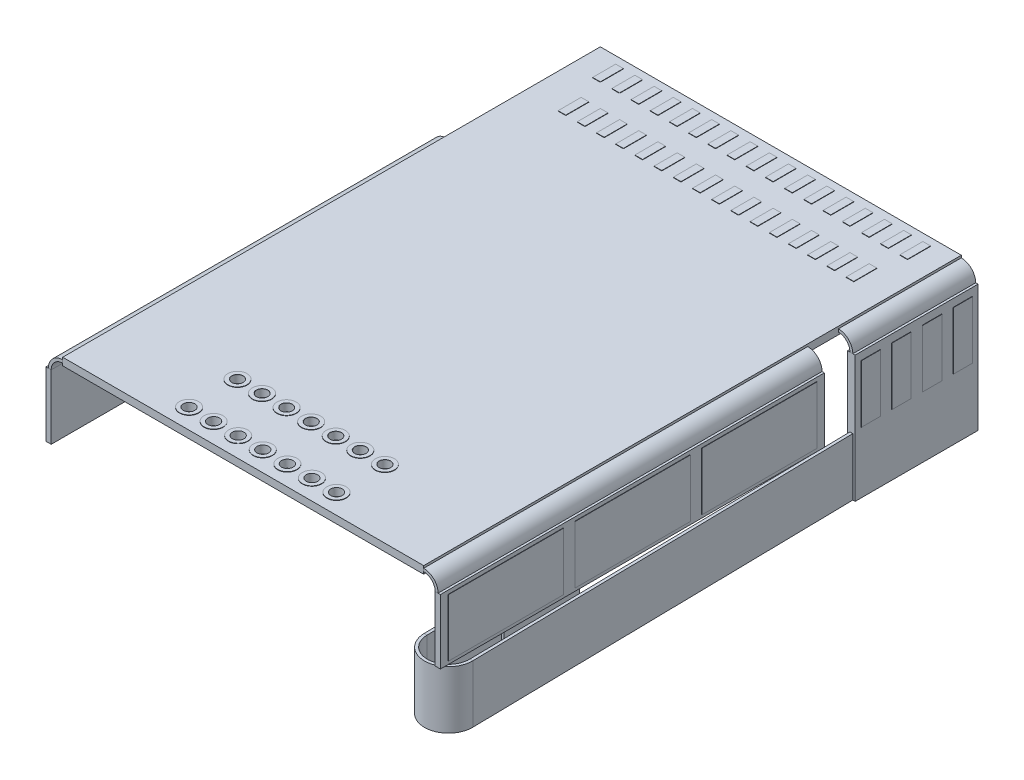
from build123d import *

# Parameters (mm, degrees)
SKETCH1_W                  = 9.4
SKETCH1_H                  = 14
BASE_FLANGE2_DEPTH         = 0.075
EDGE_FLANGE3_DEPTH         = 3.2
EDGE_FLANGE10_DEPTH        = 1.5
HEM4_START                 = -3.675
HEM4_DEPTH                 = 1.5
EDGE_FLANGE11_DEPTH        = 10
EDGE_FLANGE12_DEPTH        = 10
SKETCH50_W                 = 9.4
SKETCH50_H                 = 14
BOSS_EXTRUDE3_DEPTH        = 0.06
SKETCH51_W                 = 9.4
SKETCH51_H                 = 14
BOSS_EXTRUDE4_DEPTH        = 0.06
SKETCH79_W                 = 10
SKETCH79_H                 = 1.679903811
BOSS_EXTRUDE17_DEPTH       = 0.06
SKETCH80_W                 = 10
SKETCH80_H                 = 1.679903811
BOSS_EXTRUDE18_DEPTH       = 0.06
BOSS_EXTRUDE10_DEPTH       = 0.06
BOSS_EXTRUDE11_DEPTH       = 0.06
SKETCH66_W                 = 3.2
SKETCH66_H                 = 3.3
BOSS_EXTRUDE12_DEPTH       = 0.06
SKETCH67_W                 = 3.2
SKETCH67_H                 = 3.3
BOSS_EXTRUDE13_DEPTH       = 0.06
SKETCH68_W                 = 0.5
SKETCH68_H                 = 1.5
BOSS_EXTRUDE14_DEPTH       = 0.01
F_0_3_0_3_DIAMETER_HOLE1_D = 0.3
SKETCH71_R                 = 0.250054371
SKETCH71_R_2               = 0.15
BOSS_EXTRUDE15_DEPTH       = 0.01
SKETCH72_W                 = 0.2
SKETCH72_H                 = 0.6
BOSS_EXTRUDE16_DEPTH       = 0.01
SKETCH81_W                 = 3
SKETCH81_H                 = 1.5
BOSS_EXTRUDE19_DEPTH       = 0.01


# Read off the part's stored shape, not the designer's step: Hem4
# Sheet-metal steps are written as plain solids
with BuildPart() as part:
    # Sketch1 → Base-Flange2 (new body)
    with BuildSketch(Plane(origin=(0, 0, 0), x_dir=(1, 0, 0), z_dir=(0, 1, 0))):
        with Locations((0, -7)):
            Rectangle(SKETCH1_W, SKETCH1_H)
    extrude(amount=-BASE_FLANGE2_DEPTH)

    # Edge-Flange3 section (across the edge) → Edge-Flange3 (add)
    with BuildSketch(Plane(origin=(5, -0.075, 0), x_dir=(-1, 0, 0), z_dir=(0, 0, 1))):
        with BuildLine():
            Line((-0.075, 0.3), (-0.075, 3.6))
            Line((-0.075, 3.6), (0, 3.6))
            Line((0, 3.6), (0, 0.3))
            ThreePointArc((0, 0.3), (0.087867966, 0.087867966), (0.3, 0))
            Line((0.3, 0), (0.3, -0.075))
            ThreePointArc((0.3, -0.075), (0.034834957, 0.034834957), (-0.075, 0.3))
        make_face()
    extrude(amount=EDGE_FLANGE3_DEPTH)

    # Edge-Flange10 section (across the edge) → Edge-Flange10 (add)
    with BuildSketch(Plane(origin=(5.075, -2.175, 3.200872687), x_dir=(0.9998476951563914, 3.4163591665845785e-15, -0.017452406437276774), z_dir=(0, -1, 0))):
        with BuildLine():
            Line((-0.075, 0.000872687), (-0.075, 10.069345485))
            Line((-0.075, 10.069345485), (0, 10.069345485))
            Line((0, 10.069345485), (0, 0.000872687))
            ThreePointArc((0, 0.000872687), (3.808e-06, 3.3e-08), (1.523e-05, -0.000872554))
            Line((1.523e-05, -0.000872554), (-0.074973347, -0.002181484))
            ThreePointArc((-0.074973347, -0.002181484), (-0.074993337, -0.000654457), (-0.075, 0.000872687))
        make_face()
    extrude(amount=EDGE_FLANGE10_DEPTH)

    # Hem4 outline → Hem4 (add)
    with BuildSketch(Plane(origin=(0, 0, 0), x_dir=(1, 0, 0), z_dir=(0, 1, 0)).offset(HEM4_START)):
        with BuildLine():
            Line((4.006539953, -9.314796551), (3.931551375, -9.316105481))
            Line((3.931551375, -9.316105481), (4.000924691, -13.29050007))
            ThreePointArc((4.000924691, -13.29050007), (4.636737254, -13.904497125), (5.25073431, -13.268684562))
            Line((5.25073431, -13.268684562), (5.175745733, -13.269993492))
            ThreePointArc((5.175745733, -13.269993492), (4.635428324, -13.829508548), (4.075913268, -13.289191139))
            Line((4.075913268, -13.289191139), (4.006539953, -9.314796551))
        make_face()
    extrude(amount=HEM4_DEPTH)

    # Edge-Flange11 section (across the edge) → Edge-Flange11 (add)
    with BuildSketch(Plane(origin=(5, -0.075, 4), x_dir=(-1, 0, 0), z_dir=(0, 0, 1))):
        with BuildLine():
            Line((-0.075, 0.3), (-0.075, 1.979903811))
            Line((-0.075, 1.979903811), (0, 1.979903811))
            Line((0, 1.979903811), (0, 0.3))
            ThreePointArc((0, 0.3), (0.087867966, 0.087867966), (0.3, 0))
            Line((0.3, 0), (0.3, -0.075))
            ThreePointArc((0.3, -0.075), (0.034834957, 0.034834957), (-0.075, 0.3))
        make_face()
    extrude(amount=EDGE_FLANGE11_DEPTH)

    # Edge-Flange12 section (across the edge) → Edge-Flange12 (add)
    with BuildSketch(Plane(origin=(-5, -0.075, 14), x_dir=(1, 0, 0), z_dir=(0, 0, -1))):
        with BuildLine():
            Line((-0.075, 0.3), (-0.075, 1.979903811))
            Line((-0.075, 1.979903811), (0, 1.979903811))
            Line((0, 1.979903811), (0, 0.3))
            ThreePointArc((0, 0.3), (0.087867966, 0.087867966), (0.3, 0))
            Line((0.3, 0), (0.3, -0.075))
            ThreePointArc((0.3, -0.075), (0.034834957, 0.034834957), (-0.075, 0.3))
        make_face()
    extrude(amount=EDGE_FLANGE12_DEPTH)

    # Sketch50 → Boss-Extrude3 (add)
    with BuildSketch(Plane(origin=(0, 0, 0), x_dir=(1, 0, 0), z_dir=(0, 1, 0))):
        with Locations((0, -7)):
            Rectangle(SKETCH50_W, SKETCH50_H)
    extrude(amount=BOSS_EXTRUDE3_DEPTH)

    # Sketch51 → Boss-Extrude4 (add)
    with BuildSketch(Plane.XZ.offset(0.075)):
        with Locations((0, 7)):
            Rectangle(SKETCH51_W, SKETCH51_H)
    extrude(amount=BOSS_EXTRUDE4_DEPTH)

    # Sketch79 → Boss-Extrude17 (add)
    with BuildSketch(Plane(origin=(5.075, 0, 0), x_dir=(0, 0, -1), z_dir=(1, 0, 0))):
        with Locations((-9, -1.214951905)):
            Rectangle(SKETCH79_W, SKETCH79_H)
    extrude(amount=BOSS_EXTRUDE17_DEPTH)

    # Sketch80 → Boss-Extrude18 (add)
    with BuildSketch(Plane.ZY.offset(5.075)):
        with Locations((9, -1.214951905)):
            Rectangle(SKETCH80_W, SKETCH80_H)
    extrude(amount=BOSS_EXTRUDE18_DEPTH)

    # Sketch64 → Boss-Extrude10 (add)
    with BuildSketch(Plane(origin=(3.767790182, 0, -0.065767022), x_dir=(0.017452406437276805, 0, 0.9998476951563915), z_dir=(-0.9998476951563915, -2.8857195987886393e-15, 0.017452406437276805))):
        Polygon((9.383301626, -2.925), (9.383301626, -1.425), (11.383301626, -1.425), (11.383301626, -2.725), (11.383301626, -4.425), (9.383301626, -4.425), align=None)
    extrude(amount=BOSS_EXTRUDE10_DEPTH)

    # Sketch65 → Boss-Extrude11 (add)
    with BuildSketch(Plane(origin=(3.842778759, 0, -0.067075953), x_dir=(-0.01745240643727681, 0, -0.9998476951563915), z_dir=(0.9998476951563915, 2.8857195987886393e-15, -0.01745240643727681))):
        Polygon((-9.383301626, -2.925), (-9.383301626, -1.425), (-11.383301626, -1.425), (-11.383301626, -2.925), (-11.383301626, -4.425), (-9.383301626, -4.425), align=None)
    extrude(amount=BOSS_EXTRUDE11_DEPTH)

    # Sketch66 → Boss-Extrude12 (add)
    with BuildSketch(Plane(origin=(5.075, 0, 0), x_dir=(0, 0, -1), z_dir=(1, 0, 0))):
        with Locations((-1.6, -2.025)):
            Rectangle(SKETCH66_W, SKETCH66_H)
    extrude(amount=BOSS_EXTRUDE12_DEPTH)

    # Sketch67 → Boss-Extrude13 (add)
    with BuildSketch(Plane.ZY.offset(-5)):
        with Locations((1.6, -2.025)):
            Rectangle(SKETCH67_W, SKETCH67_H)
    extrude(amount=BOSS_EXTRUDE13_DEPTH)

    # Sketch68 → Boss-Extrude14 (add)
    with BuildSketch(Plane(origin=(5.135, 0, 0), x_dir=(0, 0, -1), z_dir=(1, 0, 0))):
        with Locations((-2, -1.324960776)):
            Rectangle(SKETCH68_W, SKETCH68_H)
        with Locations((-2.8, -1.324960776)):
            Rectangle(SKETCH68_W, SKETCH68_H)
        with Locations((-1.2, -1.324960776)):
            Rectangle(SKETCH68_W, SKETCH68_H)
        with Locations((-0.4, -1.324960776)):
            Rectangle(SKETCH68_W, SKETCH68_H)
    extrude(amount=BOSS_EXTRUDE14_DEPTH)

    # Ø0.3 (0.3) Diameter Hole1 (through all)
    with Locations(Plane(origin=(0, 0.06, 0), x_dir=(1, 0, 0), z_dir=(0, 1, 0))):
        with Locations((-1.92, -13.49), (-1.28, -13.49), (-0.64, -13.49), (0, -13.49), (0.64, -13.49), (1.28, -13.49), (1.92, -13.49), (-1.28, -12.22), (-0.64, -12.22), (0, -12.22), (0.64, -12.22), (1.28, -12.22), (1.92, -12.22), (-1.92, -12.22)):
            Hole(F_0_3_0_3_DIAMETER_HOLE1_D / 2)

    # Sketch71 → Boss-Extrude15 (add)
    # profile 1 of 14: a face of its own
    with BuildSketch(Plane(origin=(0, 0.06, 0), x_dir=(1, 0, 0), z_dir=(0, 1, 0))):
        with Locations(Location((-1.92, -13.49, 0), (0, 0, 270))):
            Circle(SKETCH71_R)
        with Locations(Location((-1.92, -13.49, 0), (0, 0, 270))):
            Circle(SKETCH71_R_2, mode=Mode.SUBTRACT)
    # profile 2 of 14: a face of its own
    with BuildSketch(Plane(origin=(0, 0.06, 0), x_dir=(1, 0, 0), z_dir=(0, 1, 0))):
        with Locations(Location((-1.28, -13.49, 0), (0, 0, 270))):
            Circle(SKETCH71_R)
        with Locations(Location((-1.28, -13.49, 0), (0, 0, 270))):
            Circle(SKETCH71_R_2, mode=Mode.SUBTRACT)
    # profile 3 of 14: a face of its own
    with BuildSketch(Plane(origin=(0, 0.06, 0), x_dir=(1, 0, 0), z_dir=(0, 1, 0))):
        with Locations(Location((-0.64, -13.49, 0), (0, 0, 270))):
            Circle(SKETCH71_R)
        with Locations(Location((-0.64, -13.49, 0), (0, 0, 270))):
            Circle(SKETCH71_R_2, mode=Mode.SUBTRACT)
    # profile 4 of 14: a face of its own
    with BuildSketch(Plane(origin=(0, 0.06, 0), x_dir=(1, 0, 0), z_dir=(0, 1, 0))):
        with Locations(Location((0, -13.49, 0), (0, 0, 270))):
            Circle(SKETCH71_R)
        with Locations(Location((0, -13.49, 0), (0, 0, 270))):
            Circle(SKETCH71_R_2, mode=Mode.SUBTRACT)
    # profile 5 of 14: a face of its own
    with BuildSketch(Plane(origin=(0, 0.06, 0), x_dir=(1, 0, 0), z_dir=(0, 1, 0))):
        with Locations(Location((0.64, -13.49, 0), (0, 0, 270))):
            Circle(SKETCH71_R)
        with Locations(Location((0.64, -13.49, 0), (0, 0, 270))):
            Circle(SKETCH71_R_2, mode=Mode.SUBTRACT)
    # profile 6 of 14: a face of its own
    with BuildSketch(Plane(origin=(0, 0.06, 0), x_dir=(1, 0, 0), z_dir=(0, 1, 0))):
        with Locations(Location((1.28, -13.49, 0), (0, 0, 270))):
            Circle(SKETCH71_R)
        with Locations(Location((1.28, -13.49, 0), (0, 0, 270))):
            Circle(SKETCH71_R_2, mode=Mode.SUBTRACT)
    # profile 7 of 14: a face of its own
    with BuildSketch(Plane(origin=(0, 0.06, 0), x_dir=(1, 0, 0), z_dir=(0, 1, 0))):
        with Locations(Location((1.92, -13.49, 0), (0, 0, 270))):
            Circle(SKETCH71_R)
        with Locations(Location((1.92, -13.49, 0), (0, 0, 270))):
            Circle(SKETCH71_R_2, mode=Mode.SUBTRACT)
    # profile 8 of 14: a face of its own
    with BuildSketch(Plane(origin=(0, 0.06, 0), x_dir=(1, 0, 0), z_dir=(0, 1, 0))):
        with Locations(Location((-1.28, -12.23, 0), (0, 0, 270))):
            Circle(SKETCH71_R)
        with Locations(Location((-1.28, -12.23, 0), (0, 0, 1.910213172))):
            Circle(SKETCH71_R_2, mode=Mode.SUBTRACT)
    # profile 9 of 14: a face of its own
    with BuildSketch(Plane(origin=(0, 0.06, 0), x_dir=(1, 0, 0), z_dir=(0, 1, 0))):
        with Locations(Location((-0.64, -12.23, 0), (0, 0, 270))):
            Circle(SKETCH71_R)
        with Locations(Location((-0.64, -12.23, 0), (0, 0, 1.910213172))):
            Circle(SKETCH71_R_2, mode=Mode.SUBTRACT)
    # profile 10 of 14: a face of its own
    with BuildSketch(Plane(origin=(0, 0.06, 0), x_dir=(1, 0, 0), z_dir=(0, 1, 0))):
        with Locations(Location((0, -12.23, 0), (0, 0, 270))):
            Circle(SKETCH71_R)
        with Locations(Location((0, -12.23, 0), (0, 0, 1.910213172))):
            Circle(SKETCH71_R_2, mode=Mode.SUBTRACT)
    # profile 11 of 14: a face of its own
    with BuildSketch(Plane(origin=(0, 0.06, 0), x_dir=(1, 0, 0), z_dir=(0, 1, 0))):
        with Locations(Location((0.64, -12.23, 0), (0, 0, 270))):
            Circle(SKETCH71_R)
        with Locations(Location((0.64, -12.23, 0), (0, 0, 1.910213172))):
            Circle(SKETCH71_R_2, mode=Mode.SUBTRACT)
    # profile 12 of 14: a face of its own
    with BuildSketch(Plane(origin=(0, 0.06, 0), x_dir=(1, 0, 0), z_dir=(0, 1, 0))):
        with Locations(Location((1.28, -12.23, 0), (0, 0, 270))):
            Circle(SKETCH71_R)
        with Locations(Location((1.28, -12.23, 0), (0, 0, 1.910213172))):
            Circle(SKETCH71_R_2, mode=Mode.SUBTRACT)
    # profile 13 of 14: a face of its own
    with BuildSketch(Plane(origin=(0, 0.06, 0), x_dir=(1, 0, 0), z_dir=(0, 1, 0))):
        with Locations(Location((1.92, -12.23, 0), (0, 0, 270))):
            Circle(SKETCH71_R)
        with Locations(Location((1.92, -12.23, 0), (0, 0, 1.910213172))):
            Circle(SKETCH71_R_2, mode=Mode.SUBTRACT)
    # profile 14 of 14: a face of its own
    with BuildSketch(Plane(origin=(0, 0.06, 0), x_dir=(1, 0, 0), z_dir=(0, 1, 0))):
        with Locations(Location((-1.92, -12.23, 0), (0, 0, 270))):
            Circle(SKETCH71_R)
        with Locations(Location((-1.92, -12.23, 0), (0, 0, 1.910213172))):
            Circle(SKETCH71_R_2, mode=Mode.SUBTRACT)
    extrude(amount=BOSS_EXTRUDE15_DEPTH)

    # Sketch72 → Boss-Extrude16 (add)
    with BuildSketch(Plane(origin=(0, 0.06, 0), x_dir=(1, 0, 0), z_dir=(0, 1, 0))):
        with Locations((-3.5, -0.5)):
            Rectangle(SKETCH72_W, SKETCH72_H)
        with Locations((-4, -0.5)):
            Rectangle(SKETCH72_W, SKETCH72_H)
        with Locations((-3, -0.5)):
            Rectangle(SKETCH72_W, SKETCH72_H)
        with Locations((-2.5, -0.5)):
            Rectangle(SKETCH72_W, SKETCH72_H)
        with Locations((-2, -0.5)):
            Rectangle(SKETCH72_W, SKETCH72_H)
        with Locations((-1.5, -0.5)):
            Rectangle(SKETCH72_W, SKETCH72_H)
        with Locations((-1, -0.5)):
            Rectangle(SKETCH72_W, SKETCH72_H)
        with Locations((-0.5, -0.5)):
            Rectangle(SKETCH72_W, SKETCH72_H)
        with Locations((0, -0.5)):
            Rectangle(SKETCH72_W, SKETCH72_H)
        with Locations((0.5, -0.5)):
            Rectangle(SKETCH72_W, SKETCH72_H)
        with Locations((1, -0.5)):
            Rectangle(SKETCH72_W, SKETCH72_H)
        with Locations((1.5, -0.5)):
            Rectangle(SKETCH72_W, SKETCH72_H)
        with Locations((2, -0.5)):
            Rectangle(SKETCH72_W, SKETCH72_H)
        with Locations((2.5, -0.5)):
            Rectangle(SKETCH72_W, SKETCH72_H)
        with Locations((3, -0.5)):
            Rectangle(SKETCH72_W, SKETCH72_H)
        with Locations((3.5, -0.5)):
            Rectangle(SKETCH72_W, SKETCH72_H)
        with Locations((4, -0.5)):
            Rectangle(SKETCH72_W, SKETCH72_H)
        with Locations((-3.2, -1.7)):
            Rectangle(SKETCH72_W, SKETCH72_H)
        with Locations((-3.7, -1.7)):
            Rectangle(SKETCH72_W, SKETCH72_H)
        with Locations((-2.7, -1.7)):
            Rectangle(SKETCH72_W, SKETCH72_H)
        with Locations((-2.2, -1.7)):
            Rectangle(SKETCH72_W, SKETCH72_H)
        with Locations((-1.7, -1.7)):
            Rectangle(SKETCH72_W, SKETCH72_H)
        with Locations((-1.2, -1.7)):
            Rectangle(SKETCH72_W, SKETCH72_H)
        with Locations((-0.7, -1.7)):
            Rectangle(SKETCH72_W, SKETCH72_H)
        with Locations((-0.2, -1.7)):
            Rectangle(SKETCH72_W, SKETCH72_H)
        with Locations((0.3, -1.7)):
            Rectangle(SKETCH72_W, SKETCH72_H)
        with Locations((0.8, -1.7)):
            Rectangle(SKETCH72_W, SKETCH72_H)
        with Locations((1.3, -1.7)):
            Rectangle(SKETCH72_W, SKETCH72_H)
        with Locations((1.8, -1.7)):
            Rectangle(SKETCH72_W, SKETCH72_H)
        with Locations((2.3, -1.7)):
            Rectangle(SKETCH72_W, SKETCH72_H)
        with Locations((2.8, -1.7)):
            Rectangle(SKETCH72_W, SKETCH72_H)
        with Locations((3.3, -1.7)):
            Rectangle(SKETCH72_W, SKETCH72_H)
        with Locations((3.8, -1.7)):
            Rectangle(SKETCH72_W, SKETCH72_H)
    extrude(amount=BOSS_EXTRUDE16_DEPTH)

    # Sketch81 → Boss-Extrude19 (add)
    with BuildSketch(Plane(origin=(5.135, 0, 0), x_dir=(0, 0, -1), z_dir=(1, 0, 0))):
        with Locations((-9, -1.222022025)):
            Rectangle(SKETCH81_W, SKETCH81_H)
        with Locations((-12.3, -1.222022025)):
            Rectangle(SKETCH81_W, SKETCH81_H)
        with Locations((-5.7, -1.222022025)):
            Rectangle(SKETCH81_W, SKETCH81_H)
    extrude(amount=BOSS_EXTRUDE19_DEPTH)


solid = part.part
